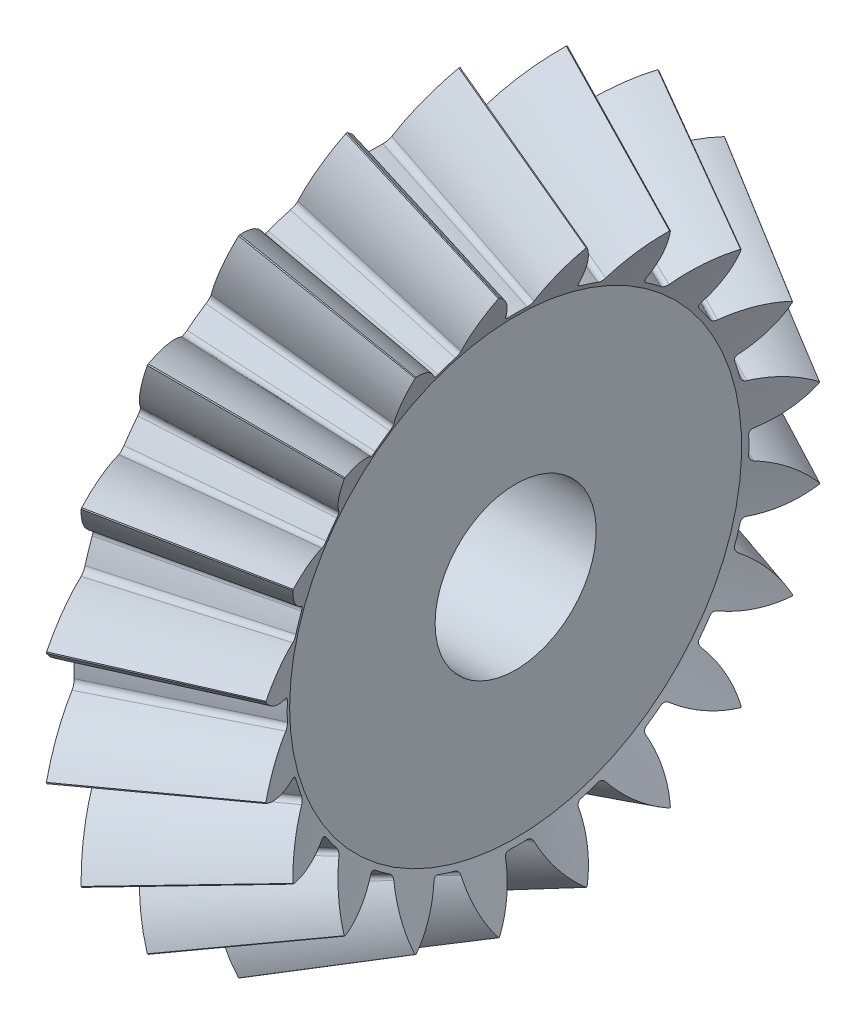
from build123d import *

# Parameters (mm, degrees)
TEETHCUTS_COUNT = 20
TEETHCUTS_ANGLE = 342
HUBSKE_R        = 22.949247136
HUB_DEPTH       = 0.0001016
BORSKE_R        = 6.35
BORE_DEPTH      = 52.025427232


with BuildPart() as part:
    # BasProSke → Base-Revolve (revolve)
    with BuildSketch(Plane(origin=(0, 0, 0), x_dir=(1, 0, 0), z_dir=(0, 1, 0)), mode=Mode.PRIVATE) as base_revolve_sk:
        Polygon((0, 0), (0, 22.949247137), (2.753192241, 28.455631612), (13.770787563, 22.092758942), (11.633227823, 17.817639468), (11.633227823, 0), align=None)
    revolve(base_revolve_sk.sketch.rotate(Axis((-10, 0, 0), (1, 0, 0)), 180), axis=Axis((-10, 0, 0), (1, 0, 0)))

    # ToothCut: read off the stored shape, not the designer's step
    # ToothCut: loft between two sections, ruled curve by curve
    toothcut_from = [
        Edge.make_bspline([(52.028752374, 0.006751881, -0.010212966), (52.026203005, 0.001653143, -0.014426508), (52.023055145, -0.004642576, -0.013586713), (52.021020666, -0.008711535, -0.008150278)], [0, 0, 0, 0, 1, 1, 1, 1], 3, [1, 0.818726488, 0.818726488, 1]),
        Edge.make_bspline([(52.021020666, -0.008711535, 0.008150278), (52.023055145, -0.004642576, 0.013586713), (52.026203005, 0.001653143, 0.014426508), (52.028752374, 0.006751881, 0.010212966)], [0, 0, 0, 0, 1, 1, 1, 1], 3, [1, 0.818726488, 0.818726488, 1]),
        Edge.make_bspline([(52.021020666, -0.008711535, -0.008150278), (52.020667507, -0.009417853, -0.007206584), (52.020378954, -0.009994959, -0.006158801), (52.020161048, -0.01043077, -0.005028867)], [0, 0, 0, 0, 1, 1, 1, 1], 3, [1, 0.993020528, 0.993020528, 1]),
        Edge.make_bspline([(52.020161048, -0.01043077, 0.005028867), (52.020378954, -0.009994959, 0.006158801), (52.020667507, -0.009417853, 0.007206584), (52.021020666, -0.008711535, 0.008150278)], [0, 0, 0, 0, 1, 1, 1, 1], 3, [1, 0.993020528, 0.993020528, 1]),
        Edge.make_bspline([(52.020161048, -0.01043077, -0.005028867), (52.019533142, -0.011686583, -0.001772898), (52.019533142, -0.011686583, 0.001772898), (52.020161048, -0.01043077, 0.005028867)], [0, 0, 0, 0, 1, 1, 1, 1], 3, [1, 0.945507875, 0.945507875, 1]),
        Edge.make_line((52.028752374, 0.006751881, 0.010212966), (52.028752374, 0.006751881, -0.010212966)),
    ]
    toothcut_to = [
        Edge.make_bspline([(2.823477349, 28.596201828, -4.946205285), (2.205027764, 27.35930266, -3.213462256), (1.373332732, 25.695912596, -2.006725037), (0.413688956, 23.776625047, -1.449753786)], [0, 0, 0, 0, 1, 1, 1, 1], 3, [1, 0.96581411, 0.96581411, 1]),
        Edge.make_bspline([(0.413688956, 23.776625047, 1.449753786), (1.373332732, 25.695912596, 2.006725037), (2.205027764, 27.35930266, 3.213462256), (2.823477349, 28.596201828, 4.946205285)], [0, 0, 0, 0, 1, 1, 1, 1], 3, [1, 0.96581411, 0.96581411, 1]),
        Edge.make_bspline([(0.413688956, 23.776625047, -1.449753786), (0.301482508, 23.552212151, -1.384629865), (0.232378612, 23.414004359, -1.176505339), (0.236961517, 23.423170169, -0.917492704)], [0, 0, 0, 0, 1, 1, 1, 1], 3, [1, 0.852472145, 0.852472145, 1]),
        Edge.make_bspline([(0.236961517, 23.423170169, 0.917492704), (0.232378612, 23.414004359, 1.176505339), (0.301482508, 23.552212151, 1.384629865), (0.413688956, 23.776625047, 1.449753786)], [0, 0, 0, 0, 1, 1, 1, 1], 3, [1, 0.852472145, 0.852472145, 1]),
        Edge.make_bspline([(0.236961517, 23.423170169, -0.917492704), (0.247781287, 23.44480971, -0.305990374), (0.247781287, 23.44480971, 0.305990374), (0.236961517, 23.423170169, 0.917492704)], [0, 0, 0, 0, 1, 1, 1, 1], 3, [1, 0.99947883, 0.99947883, 1]),
        Edge.make_line((2.823477349, 28.596201828, 4.946205285), (2.823477349, 28.596201828, -4.946205285)),
    ]
    toothcut = Solid(Shell([*[Face.make_surface_from_curves(toothcut_from[k], toothcut_to[k]) for k in range(6)], Face(Wire(toothcut_from)), Face(Wire(toothcut_to))]))
    add(toothcut, mode=Mode.SUBTRACT)

    # TeethCuts: ToothCut ×20 about axis
    teethcuts_axis = Axis((-10, 0, 0), (1, 0, 0))
    for i in range(1, TEETHCUTS_COUNT):
        add(toothcut.rotate(teethcuts_axis, i * TEETHCUTS_ANGLE / (TEETHCUTS_COUNT - 1)), mode=Mode.SUBTRACT)

    # HubSke → Hub (add)
    with BuildSketch(Plane.ZY):
        Circle(HUBSKE_R)
    extrude(amount=HUB_DEPTH)

    # BorSke → Bore (cut, symmetric)
    with BuildSketch(Plane(origin=(0, 0, 0), x_dir=(0, 0, -1), z_dir=(1, 0, 0))):
        with Locations(Location((0, 0, 0), (0, 0, 180))):
            Circle(BORSKE_R)
    extrude(amount=BORE_DEPTH, both=True, mode=Mode.SUBTRACT)


solid = part.part
